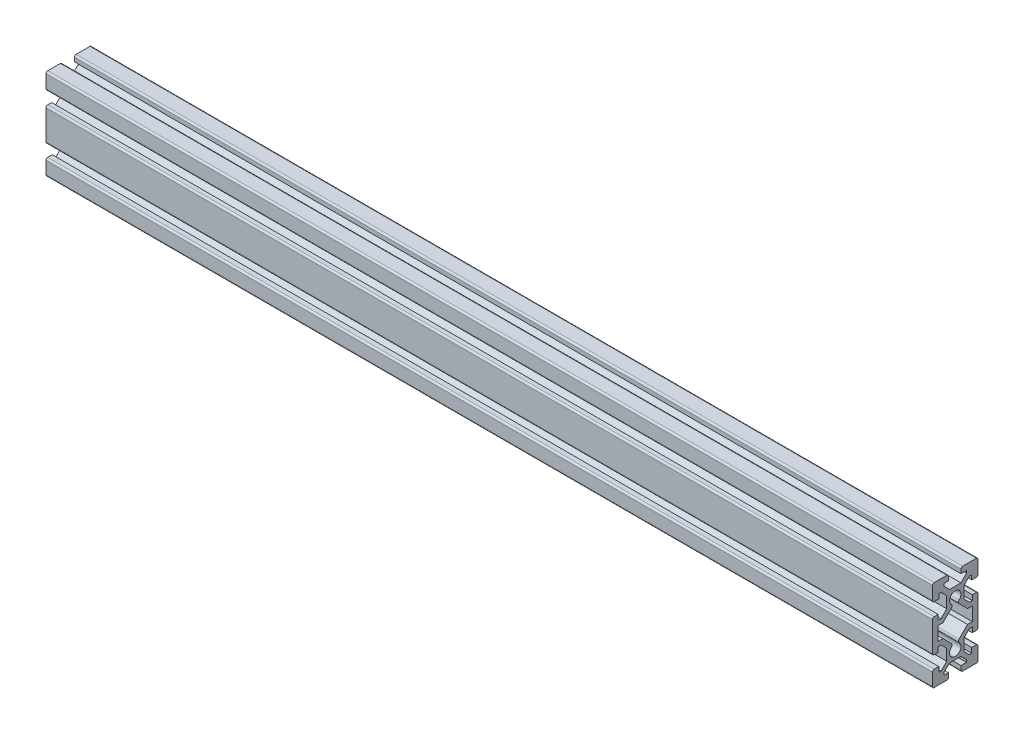
from build123d import *

# Parameters (mm, degrees)
ESTRUSIONE_ESTRUSIONE1_DEPTH = 780


with BuildPart() as part:
    # Schizzo1 → Estrusione-Estrusione1 (new body)
    with BuildSketch(Plane(origin=(0, 0, 0), x_dir=(0, 0, -1), z_dir=(1, 0, 0))):
        with BuildLine():
            Line((6.5, -39.5), (18.5, -39.5))
            ThreePointArc((18.5, -39.5), (19.560660172, -39.060660172), (20, -38))
            Line((20, -38), (20, -27))
            ThreePointArc((20, -27), (19.560660172, -25.939339828), (18.5, -25.5))
            Line((18.5, -25.5), (14.5, -25.5))
            Line((14.5, -25.5), (14.5, -29.949747468))
            Line((14.5, -29.949747468), (12.449747468, -29.949747468))
            Line((12.449747468, -29.949747468), (7.5, -25))
            Line((7.5, -25), (7.5, -15))
            Line((7.5, -15), (12.449747468, -10.050252532))
            Line((12.449747468, -10.050252532), (15, -10.050252532))
            Line((15, -10.050252532), (15, -14.5))
            Line((15, -14.5), (18.5, -14.5))
            ThreePointArc((18.5, -14.5), (19.560660172, -14.060660172), (20, -13))
            Line((20, -13), (20, 13))
            ThreePointArc((20, 13), (19.560660172, 14.060660172), (18.5, 14.5))
            Line((18.5, 14.5), (15, 14.5))
            Line((15, 14.5), (15, 10.050252532))
            Line((15, 10.050252532), (12.449747468, 10.050252532))
            Line((12.449747468, 10.050252532), (7.5, 15))
            Line((7.5, 15), (7.5, 25))
            Line((7.5, 25), (12.449747468, 29.949747468))
            Line((12.449747468, 29.949747468), (14.5, 29.949747468))
            Line((14.5, 29.949747468), (14.5, 26))
            Line((14.5, 26), (18.5, 26))
            ThreePointArc((18.5, 26), (19.560660172, 26.439339828), (20, 27.5))
            Line((20, 27.5), (20, 39))
            ThreePointArc((20, 39), (19.560660172, 40.060660172), (18.5, 40.5))
            Line((18.5, 40.5), (6.5, 40.5))
            ThreePointArc((6.5, 40.5), (5.439339828, 40.060660172), (5, 39))
            Line((5, 39), (5, 35.5))
            Line((5, 35.5), (9.949747468, 35.5))
            Line((9.949747468, 35.5), (9.949747468, 33.449747468))
            Line((9.949747468, 33.449747468), (5, 28.5))
            Line((5, 28.5), (-5, 28.5))
            Line((-5, 28.5), (-9.949747468, 33.449747468))
            Line((-9.949747468, 33.449747468), (-9.949747468, 35.5))
            Line((-9.949747468, 35.5), (-6, 35.5))
            Line((-6, 35.5), (-6, 39))
            ThreePointArc((-6, 39), (-6.439339828, 40.060660172), (-7.5, 40.5))
            Line((-7.5, 40.5), (-18.5, 40.5))
            ThreePointArc((-18.5, 40.5), (-19.560660172, 40.060660172), (-20, 39))
            Line((-20, 39), (-20, 27.5))
            ThreePointArc((-20, 27.5), (-19.560660172, 26.439339828), (-18.5, 26))
            Line((-18.5, 26), (-14.5, 26))
            Line((-14.5, 26), (-14.5, 29.949747468))
            Line((-14.5, 29.949747468), (-12.449747468, 29.949747468))
            Line((-12.449747468, 29.949747468), (-7.5, 25))
            Line((-7.5, 25), (-7.5, 15))
            Line((-7.5, 15), (-12.449747468, 10.050252532))
            Line((-12.449747468, 10.050252532), (-15, 10.050252532))
            Line((-15, 10.050252532), (-15, 14.5))
            Line((-15, 14.5), (-18.5, 14.5))
            ThreePointArc((-18.5, 14.5), (-19.560660172, 14.060660172), (-20, 13))
            Line((-20, 13), (-20, -13))
            ThreePointArc((-20, -13), (-19.560660172, -14.060660172), (-18.5, -14.5))
            Line((-18.5, -14.5), (-15, -14.5))
            Line((-15, -14.5), (-15, -10.050252532))
            Line((-15, -10.050252532), (-12.449747468, -10.050252532))
            Line((-12.449747468, -10.050252532), (-7.5, -15))
            Line((-7.5, -15), (-7.5, -25))
            Line((-7.5, -25), (-12.449747468, -29.949747468))
            Line((-12.449747468, -29.949747468), (-14.5, -29.949747468))
            Line((-14.5, -29.949747468), (-14.5, -25.5))
            Line((-14.5, -25.5), (-18.5, -25.5))
            ThreePointArc((-18.5, -25.5), (-19.560660172, -25.939339828), (-20, -27))
            Line((-20, -27), (-20, -38))
            ThreePointArc((-20, -38), (-19.560660172, -39.060660172), (-18.5, -39.5))
            Line((-18.5, -39.5), (-7.5, -39.5))
            ThreePointArc((-7.5, -39.5), (-6.439339828, -39.060660172), (-6, -38))
            Line((-6, -38), (-6, -34.5))
            Line((-6, -34.5), (-9.949747468, -34.5))
            Line((-9.949747468, -34.5), (-9.949747468, -32.449747468))
            Line((-9.949747468, -32.449747468), (-5, -27.5))
            Line((-5, -27.5), (5, -27.5))
            Line((5, -27.5), (9.949747468, -32.449747468))
            Line((9.949747468, -32.449747468), (9.949747468, -34.5))
            Line((9.949747468, -34.5), (5, -34.5))
            Line((5, -34.5), (5, -38))
            ThreePointArc((5, -38), (5.439339828, -39.060660172), (6.5, -39.5))
        make_face()
        with BuildLine():
            Line((-15, -6.050252532), (-15, 6.050252532))
            Line((-15, 6.050252532), (-10.792893219, 6.050252532))
            Line((-10.792893219, 6.050252532), (-3.368595607, 13.474550144))
            ThreePointArc((-3.368595607, 13.474550144), (-2.783084428, 14.921944422), (-3.416292264, 16.349116933))
            ThreePointArc((-3.416292264, 16.349116933), (0, 25), (3.416292264, 16.349116933))
            ThreePointArc((3.416292264, 16.349116933), (2.783084428, 14.921944422), (3.368595607, 13.474550144))
            Line((3.368595607, 13.474550144), (10.792893219, 6.050252532))
            Line((10.792893219, 6.050252532), (15, 6.050252532))
            Line((15, 6.050252532), (15, -6.050252532))
            Line((15, -6.050252532), (10.792893219, -6.050252532))
            Line((10.792893219, -6.050252532), (3.368595607, -13.474550144))
            ThreePointArc((3.368595607, -13.474550144), (2.783084428, -14.921944422), (3.416292264, -16.349116933))
            ThreePointArc((3.416292264, -16.349116933), (0, -25), (-3.416292264, -16.349116933))
            ThreePointArc((-3.416292264, -16.349116933), (-2.783084428, -14.921944422), (-3.368595607, -13.474550144))
            Line((-3.368595607, -13.474550144), (-10.792893219, -6.050252532))
            Line((-10.792893219, -6.050252532), (-15, -6.050252532))
        make_face(mode=Mode.SUBTRACT)
    extrude(amount=ESTRUSIONE_ESTRUSIONE1_DEPTH)


solid = part.part
